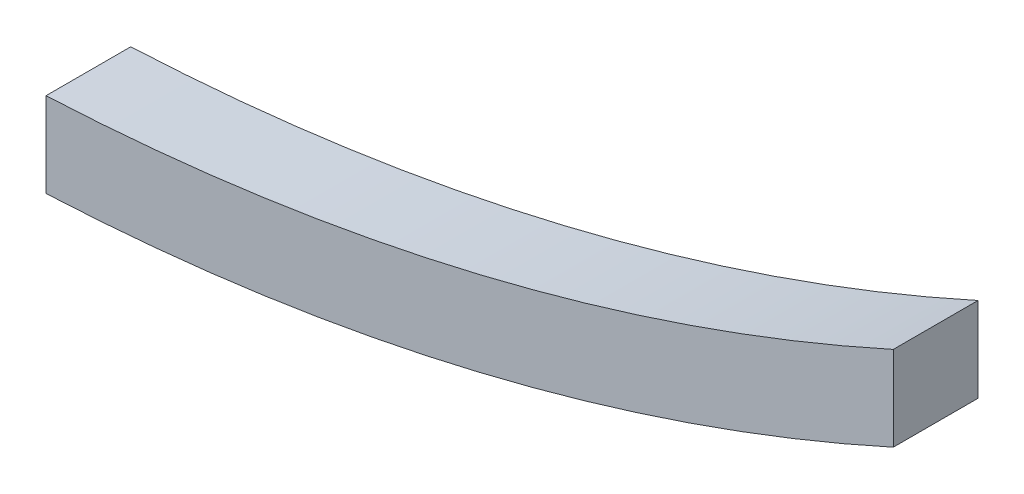
from build123d import *

# Parameters (mm, degrees)
AUFSATZ_LINEAR_AUSTRAGEN1_DEPTH = 30


with BuildPart() as part:
    # Skizze1 → Aufsatz-Linear austragen1 (new body)
    with BuildSketch(Plane.XY):
        with BuildLine():
            Line((0, 0), (0, 30))
            ThreePointArc((0, 30), (153.422856927, 51.87974238), (300, 102.2030698))
            Line((300, 102.2030698), (300, 72.2030698))
            ThreePointArc((300, 72.2030698), (153.422856927, 21.87974238), (0, 0))
        make_face()
    extrude(amount=AUFSATZ_LINEAR_AUSTRAGEN1_DEPTH)


solid = part.part
